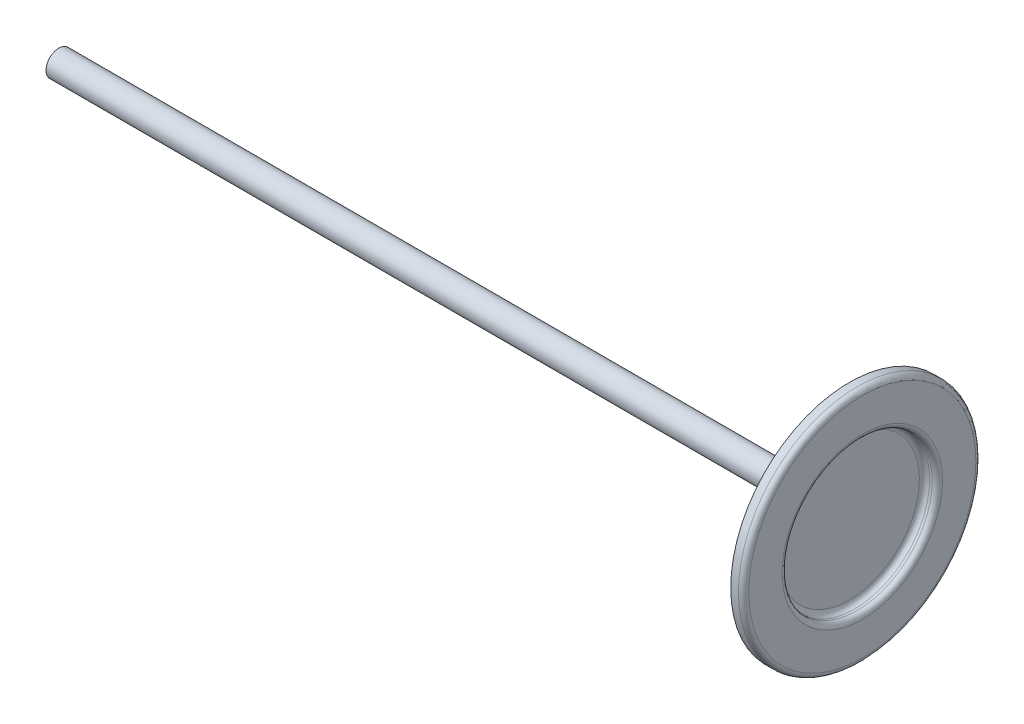
from build123d import *

# Parameters (mm, degrees)
SKETCH1_R           = 6.85
BOSS_EXTRUDE1_DEPTH = 1.6
SKETCH2_R           = 9.25
SKETCH2_R_2         = 5.85
BOSS_EXTRUDE2_DEPTH = 1
FILLET1_R           = 0.4
FILLET2_R           = 0.4
SKETCH3_R           = 1
BOSS_EXTRUDE3_DEPTH = 60
FILLET3_R           = 0.4


with BuildPart() as part:
    # Sketch1 → Boss-Extrude1 (new body)
    with BuildSketch(Plane.YZ):
        Circle(SKETCH1_R)
    extrude(amount=BOSS_EXTRUDE1_DEPTH)

    # Sketch2 → Boss-Extrude2 (add)
    with BuildSketch(Plane.YZ.offset(1.6)):
        Circle(SKETCH2_R)
        Circle(SKETCH2_R_2, mode=Mode.SUBTRACT)
    extrude(amount=BOSS_EXTRUDE2_DEPTH)

    # Fillet1
    fillet1_edges = [part.edges().sort_by_distance(p)[0] for p in [
        (1.6, -5.85, 0),
        (2.6, -5.85, 0),
    ]]
    fillet(fillet1_edges, radius=FILLET1_R)

    # Fillet2
    fillet2_edges = [part.edges().sort_by_distance(p)[0] for p in [
        (2.6, -9.25, 0),
    ]]
    fillet(fillet2_edges, radius=FILLET2_R)

    # Sketch3 → Boss-Extrude3 (add)
    with BuildSketch(Plane(origin=(0, 0, 0), x_dir=(0, -1, 0), z_dir=(-1, 0, 0))):
        Circle(SKETCH3_R)
    extrude(amount=BOSS_EXTRUDE3_DEPTH)

    # Fillet3
    fillet3_edges = [part.edges().sort_by_distance(p)[0] for p in [
        (0, 1, 0),
    ]]
    fillet(fillet3_edges, radius=FILLET3_R)


solid = part.part
